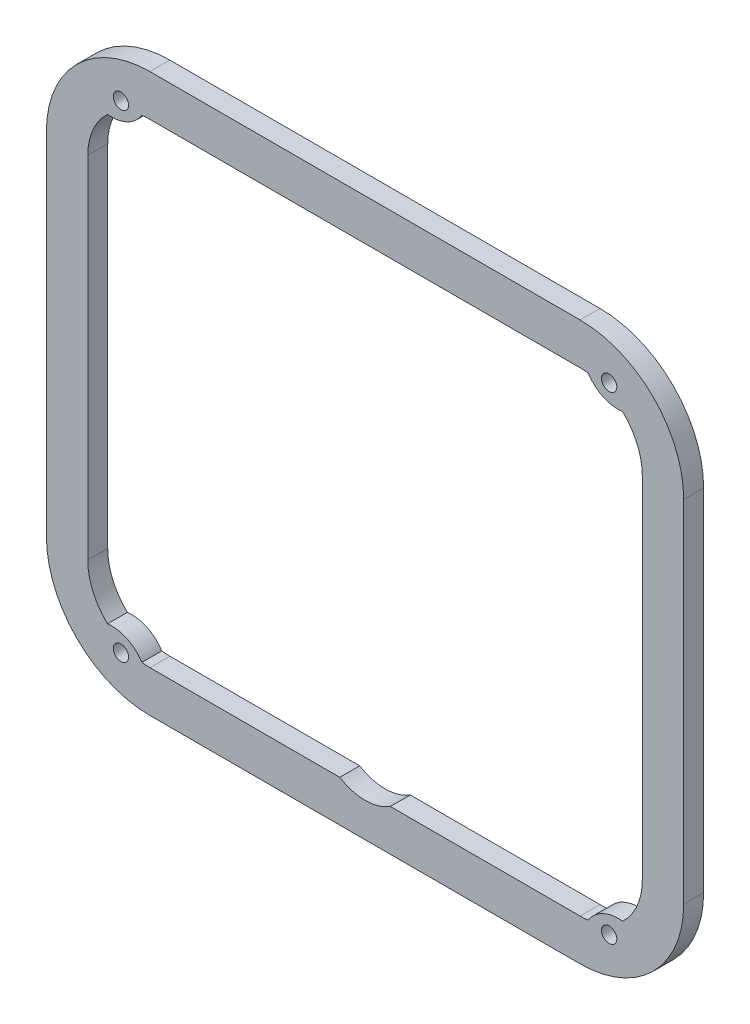
from build123d import *

# Parameters (mm, degrees)
SKETCH1_R           = 0.6096
BOSS_EXTRUDE1_DEPTH = 1.5875


with BuildPart() as part:
    # Sketch1 → Boss-Extrude1 (new body)
    with BuildSketch(Plane.XY):
        with BuildLine():
            ThreePointArc((25.4, 13.97), (22.982166479, 19.807166479), (17.145, 22.225))
            Line((17.145, 22.225), (-17.145, 22.225))
            ThreePointArc((-17.145, 22.225), (-22.982166479, 19.807166479), (-25.4, 13.97))
            Line((-25.4, 13.97), (-25.4, -13.97))
            ThreePointArc((-25.4, -13.97), (-22.982166479, -19.807166479), (-17.145, -22.225))
            Line((-17.145, -22.225), (17.145, -22.225))
            ThreePointArc((17.145, -22.225), (22.982166479, -19.807166479), (25.4, -13.97))
            Line((25.4, -13.97), (25.4, 13.97))
        make_face()
        with BuildLine():
            ThreePointArc((-17.789563521, -18.880880458), (-18.97215548, -17.838182867), (-20.528651124, -17.58705876))
            ThreePointArc((-20.528651124, -17.58705876), (-21.688755771, -15.941418903), (-22.098, -13.97))
            Line((-22.098, -13.97), (-22.098, 13.97))
            ThreePointArc((-22.098, 13.97), (-21.688755771, 15.941418903), (-20.528651124, 17.58705876))
            ThreePointArc((-20.528651124, 17.58705876), (-18.97215548, 17.838182867), (-17.789563521, 18.880880458))
            ThreePointArc((-17.789563521, 18.880880458), (-17.467969111, 18.912458897), (-17.145, 18.923))
            Line((-17.145, 18.923), (17.145, 18.923))
            ThreePointArc((17.145, 18.923), (17.467969111, 18.912458897), (17.789563521, 18.880880458))
            ThreePointArc((17.789563521, 18.880880458), (18.97215548, 17.838182867), (20.528651124, 17.58705876))
            ThreePointArc((20.528651124, 17.58705876), (21.688755771, 15.941418903), (22.098, 13.97))
            Line((22.098, 13.97), (22.098, -13.97))
            ThreePointArc((22.098, -13.97), (21.688755771, -15.941418903), (20.528651124, -17.58705876))
            ThreePointArc((20.528651124, -17.58705876), (18.97215548, -17.838182867), (17.789563521, -18.880880458))
            ThreePointArc((17.789563521, -18.880880458), (17.467969111, -18.912458897), (17.145, -18.923))
            Line((17.145, -18.923), (2.01269959, -18.923))
            ThreePointArc((2.01269959, -18.923), (0, -19.5072), (-2.01269959, -18.923))
            Line((-2.01269959, -18.923), (-17.145, -18.923))
            ThreePointArc((-17.145, -18.923), (-17.467969111, -18.912458897), (-17.789563521, -18.880880458))
        make_face(mode=Mode.SUBTRACT)
        with Locations((-19.457528855, -19.05)):
            Circle(SKETCH1_R, mode=Mode.SUBTRACT)
        with Locations((19.457528855, -19.05)):
            Circle(SKETCH1_R, mode=Mode.SUBTRACT)
        with Locations((19.457528855, 19.05)):
            Circle(SKETCH1_R, mode=Mode.SUBTRACT)
        with Locations((-19.457528855, 19.05)):
            Circle(SKETCH1_R, mode=Mode.SUBTRACT)
    extrude(amount=BOSS_EXTRUDE1_DEPTH)


solid = part.part
